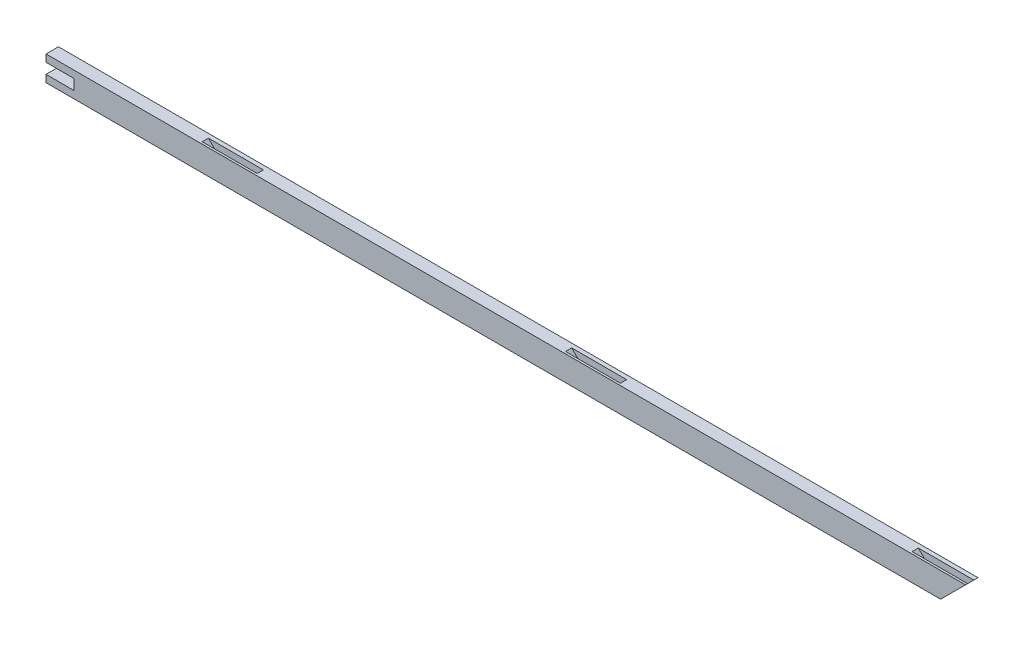
from build123d import *

# Parameters (mm, degrees)
EXTRUDE_1_DEPTH        = 12
SKETCH_2_W             = 40
SKETCH_2_H             = 6
CUT_EXTRUDE_1_DEPTH    = 6.5
DRAFT_1_ANGLE          = 45
DRAFT_2_ANGLE          = 45
PATTERN_START          = 4
PATTERN_LINEAR_1_DEPTH = 6
MIRROR_START           = 4
MIRROR_2_DEPTH         = 6
CUT_EXTRUDE_START      = -2
CUT_EXTRUDE_2_DEPTH    = 6


# Read off the part's stored shape, not the designer's step: 阵列(线性)1, 镜向2
with BuildPart() as part:
    # 草图1 → 凸台-拉伸1 (new body)
    with BuildSketch(Plane.XY):
        Polygon((0, 12), (0, 5), (27, 5), (27, -5), (0, -5), (0, -12), (862, -12), (886, 12), align=None)
    extrude(amount=EXTRUDE_1_DEPTH)

    # 草图2 → 切除-拉伸1 (cut)
    with BuildSketch(Plane.XZ.offset(12)):
        with Locations((175, 7)):
            Rectangle(SKETCH_2_W, SKETCH_2_H)
    extrude(amount=-CUT_EXTRUDE_1_DEPTH, mode=Mode.SUBTRACT)

    # 拔模1
    draft_1_faces = [part.faces().sort_by_distance(p)[0] for p in [
        (155, -8.75, 7),
    ]]
    draft(draft_1_faces, Plane(origin=(0, -5.5, 0), x_dir=(0, 0, -1), z_dir=(0, -1, 0)), DRAFT_1_ANGLE)

    # 拔模2
    draft_2_faces = [part.faces().sort_by_distance(p)[0] for p in [
        (195, -8.75, 7),
    ]]
    draft(draft_2_faces, Plane(origin=(0, -5.5, 0), x_dir=(0, 0, -1), z_dir=(0, -1, 0)), DRAFT_2_ANGLE)

    # 阵列(线性)1 outline → 阵列(线性)1 (cut)
    with BuildSketch(Plane.XY.offset(PATTERN_START)):
        Polygon((551.5, -12), (545, -5.5), (505, -5.5), (498.5, -12), align=None)
    extrude(amount=PATTERN_LINEAR_1_DEPTH, mode=Mode.SUBTRACT)

    # 镜向2 outline → 镜向2 (cut)
    with BuildSketch(Plane.XY.offset(MIRROR_START)):
        Polygon((195, 5.5), (201.5, 12), (148.5, 12), (155, 5.5), align=None)
        Polygon((545, 5.5), (551.5, 12), (498.5, 12), (505, 5.5), align=None)
    extrude(amount=MIRROR_2_DEPTH, mode=Mode.SUBTRACT)

    # 草图4 → 切除-拉伸2 (cut)
    with BuildSketch(Plane.XY.offset(12).offset(CUT_EXTRUDE_START)):
        Polygon((832.5, 12), (839, 5.5), (879.5, 5.5), (886, 12), align=None)
        Polygon((832.5, -12), (839, -5.5), (868.5, -5.5), (862, -12), align=None)
    extrude(amount=-CUT_EXTRUDE_2_DEPTH, mode=Mode.SUBTRACT)


solid = part.part
